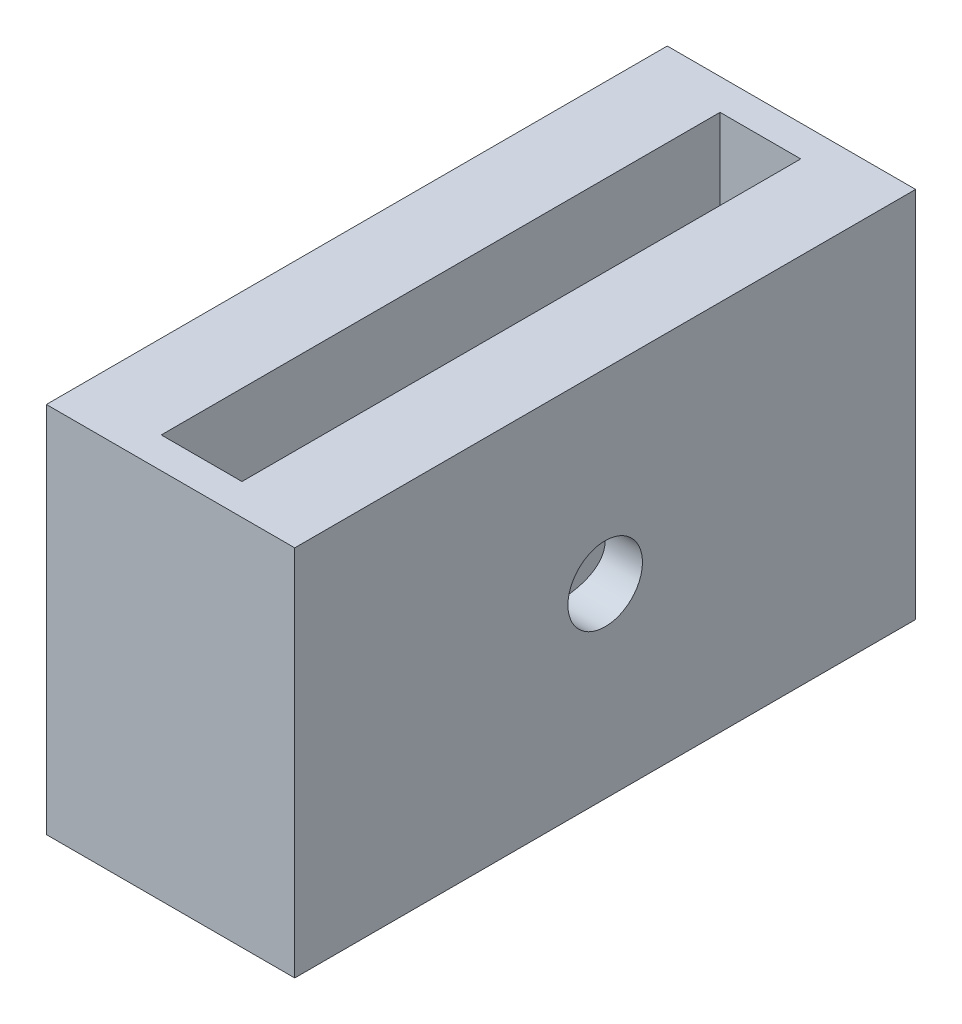
from build123d import *

# Parameters (mm, degrees)
SKETCH1_W           = 20
SKETCH1_H           = 30
BOSS_EXTRUDE1_DEPTH = 50
SKETCH3_R           = 7
CUT_EXTRUDE1_DEPTH  = 40
SKETCH4_R           = 3
CUT_EXTRUDE2_DEPTH  = 56.901699437
SKETCH5_W           = 6.5
SKETCH5_H           = 45
CUT_EXTRUDE3_DEPTH  = 60.160797848


with BuildPart() as part:
    # Sketch1 → Boss-Extrude1 (new body)
    with BuildSketch(Plane.XY):
        Rectangle(SKETCH1_W, SKETCH1_H)
    extrude(amount=BOSS_EXTRUDE1_DEPTH)

    # Sketch3 → Cut-Extrude1 (cut)
    with BuildSketch(Plane.XY):
        Circle(SKETCH3_R)
    extrude(amount=CUT_EXTRUDE1_DEPTH, mode=Mode.SUBTRACT)

    # Sketch4 → Cut-Extrude2 (cut, through all)
    with BuildSketch(Plane.ZY.offset(10)):
        with Locations((25, 0)):
            Circle(SKETCH4_R)
    extrude(amount=-CUT_EXTRUDE2_DEPTH, mode=Mode.SUBTRACT)

    # Sketch5 → Cut-Extrude3 (cut, through all)
    with BuildSketch(Plane(origin=(0, 15, 0), x_dir=(1, 0, 0), z_dir=(0, 1, 0))):
        with Locations((0, -25)):
            Rectangle(SKETCH5_W, SKETCH5_H)
    extrude(amount=-CUT_EXTRUDE3_DEPTH, mode=Mode.SUBTRACT)


solid = part.part
